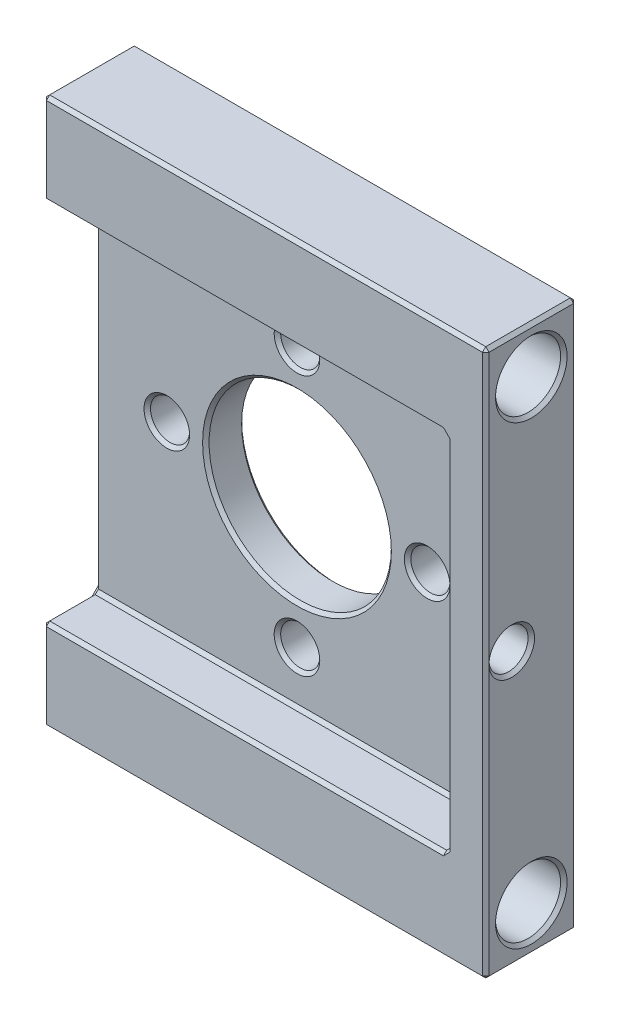
from build123d import *

# Parameters (mm, degrees)
ESQUISSE1_W             = 34
ESQUISSE1_H             = 42
BOSS_EXTRU_1_DEPTH      = 7
ESQUISSE2_W             = 31
ESQUISSE2_H             = 28
ENL_V_MAT_EXTRU_1_DEPTH = 4
ESQUISSE3_R             = 2.5
ENL_V_MAT_EXTRU_2_DEPTH = 55.488530903
ESQUISSE4_R             = 7
ESQUISSE4_R_2           = 1.5
ENL_V_MAT_EXTRU_3_DEPTH = 4
ESQUISSE5_R             = 1.5
ENL_V_MAT_EXTRU_4_DEPTH = 4
CHANFREIN2_SIZE         = 0.25


with BuildPart() as part:
    # Esquisse1 → Boss.-Extru.1 (new body)
    with BuildSketch(Plane.XY):
        with Locations((17, 21)):
            Rectangle(ESQUISSE1_W, ESQUISSE1_H)
    extrude(amount=BOSS_EXTRU_1_DEPTH)

    # Esquisse2 → Enlèv. mat.-Extru.1 (cut)
    with BuildSketch(Plane.XY.offset(7)):
        with Locations((15.5, 21)):
            Rectangle(ESQUISSE2_W, ESQUISSE2_H)
    extrude(amount=-ENL_V_MAT_EXTRU_1_DEPTH, mode=Mode.SUBTRACT)

    # Esquisse3 → Enlèv. mat.-Extru.2 (cut, through all)
    with BuildSketch(Plane.ZY):
        with Locations((3.5, 38.5)):
            Circle(ESQUISSE3_R)
        with Locations((3.5, 3.5)):
            Circle(ESQUISSE3_R)
    extrude(amount=-ENL_V_MAT_EXTRU_2_DEPTH, mode=Mode.SUBTRACT)

    # Esquisse4 → Enlèv. mat.-Extru.3 (cut)
    with BuildSketch(Plane.XY.offset(3)):
        with Locations((15.5, 21)):
            Circle(ESQUISSE4_R)
        with Locations((15.5, 31)):
            Circle(ESQUISSE4_R_2)
        with Locations((15.5, 11)):
            Circle(ESQUISSE4_R_2)
        with Locations((25.5, 21)):
            Circle(ESQUISSE4_R_2)
        with Locations((5.5, 21)):
            Circle(ESQUISSE4_R_2)
    extrude(amount=-ENL_V_MAT_EXTRU_3_DEPTH, mode=Mode.SUBTRACT)

    # Esquisse5 → Enlèv. mat.-Extru.4 (cut)
    with BuildSketch(Plane(origin=(34, 0, 0), x_dir=(0, 0, -1), z_dir=(1, 0, 0))):
        with Locations(Location((-5, 21, 0), (0, 0, 90))):
            Circle(ESQUISSE5_R)
    extrude(amount=-ENL_V_MAT_EXTRU_4_DEPTH, mode=Mode.SUBTRACT)

    # Chanfrein2
    chanfrein2_edges = [part.edges().sort_by_distance(p)[0] for p in [
        (34, 21, 7),
        (17, 42, 7),
        (0, 3.5, 7),
        (0, 21, 3),
        (0, 7, 5),
        (15.5, 35, 3),
        (0, 35, 5),
        (31, 21, 3),
        (31, 35, 5),
        (15.5, 7, 3),
        (31, 7, 5),
        (15.5, 7, 7),
        (31, 21, 7),
        (15.5, 35, 7),
        (34, 38.5, 1),
        (0, 38.5, 1),
        (34, 3.5, 1),
        (0, 3.5, 1),
        (0, 38.5, 7),
        (14, 31, 0),
        (14, 31, 3),
        (17, 42, 0),
        (14, 11, 0),
        (14, 11, 3),
        (24, 21, 0),
        (24, 21, 3),
        (34, 21, 0),
        (4, 21, 0),
        (4, 21, 3),
        (8.5, 21, 0),
        (8.5, 21, 3),
        (17, 0, 0),
        (0, 21, 0),
        (31, 19.5, 5),
        (34, 19.5, 5),
        (17, 0, 7),
        (0, 42, 3.5),
        (34, 42, 3.5),
        (34, 0, 3.5),
        (0, 0, 3.5),
    ]]
    chamfer(chanfrein2_edges, length=CHANFREIN2_SIZE - 0.0001)  # a hair under: the kernel refuses the full size


solid = part.part
